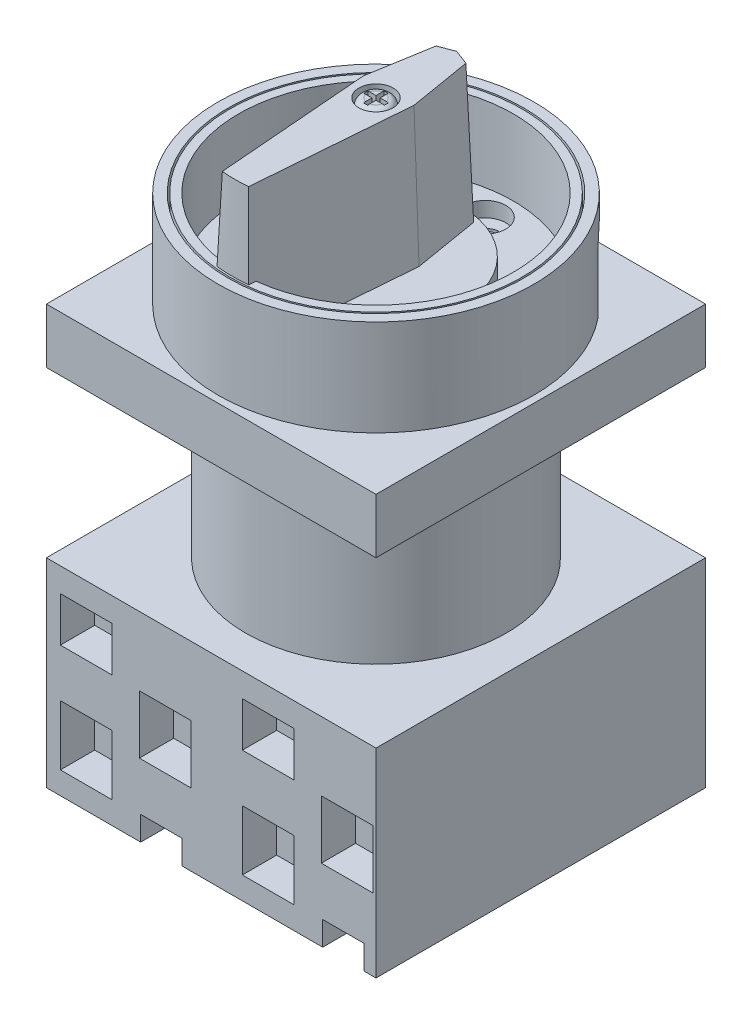
from build123d import *

# Parameters (mm, degrees)
SKETCH1_W                     = 48
SKETCH1_H                     = 48
BOSS_EXTRUDE1_DEPTH           = 29
SKETCH2_R                     = 19
BOSS_EXTRUDE2_DEPTH           = 24
SKETCH3_W                     = 48
SKETCH3_H                     = 48
BOSS_EXTRUDE3_DEPTH           = 8
SKETCH4_R                     = 23
BOSS_EXTRUDE4_DEPTH           = 14
SKETCH5_R                     = 21.5
SKETCH5_R_2                   = 21.25
SKETCH5_R_3                   = 20
CUT_EXTRUDE1_DEPTH            = 11
SKETCH6_R                     = 12.5
BOSS_EXTRUDE5_DEPTH           = 3
BOSS_EXTRUDE6_DEPTH           = 20
BOSS_EXTRUDE6_DRAFT           = 2
BOSS_EXTRUDE6_OTHER_WAY_DEPTH = 3
SKETCH10_R                    = 3
CUT_EXTRUDE2_DEPTH            = 3
SKETCH11_W                    = 7.5
SKETCH11_H                    = 6.5
SKETCH11_H_2                  = 8.737209053
SKETCH11_H_3                  = 8.5
SKETCH11_W_2                  = 6
SKETCH11_H_4                  = 3.5
CUT_EXTRUDE3_DEPTH            = 5
SKETCH12_W                    = 19.5
SKETCH12_H                    = 2.5
SKETCH13_W                    = 1
SKETCH13_H                    = 4
CUT_EXTRUDE4_DEPTH            = 1
SKETCH14_R                    = 2.5
SKETCH14_R_2                  = 2.25
CUT_EXTRUDE5_DEPTH            = 2.5
CUT_EXTRUDE6_DEPTH            = 2
FILLET1_R                     = 1
SKETCH17_R                    = 2
CUT_EXTRUDE7_DEPTH            = 5
CUT_EXTRUDE8_START            = -0.15
CUT_EXTRUDE8_DEPTH            = 5.15
SKETCH20_R                    = 21.5
SKETCH20_R_2                  = 21.25
CUT_EXTRUDE9_DEPTH            = 3
CUT_EXTRUDE10_START           = 0.8
SKETCH21_R                    = 21.25
SKETCH21_R_2                  = 5
CUT_EXTRUDE10_DEPTH           = 0.8


with BuildPart() as part:
    # Sketch1 → Boss-Extrude1 (new body)
    with BuildSketch(Plane(origin=(0, 0, 0), x_dir=(1, 0, 0), z_dir=(0, 1, 0))):
        Rectangle(SKETCH1_W, SKETCH1_H)
    extrude(amount=BOSS_EXTRUDE1_DEPTH)

    # Sketch2 → Boss-Extrude2 (add)
    with BuildSketch(Plane(origin=(0, 29, 0), x_dir=(1, 0, 0), z_dir=(0, 1, 0))):
        with Locations(Location((0, 0, 0), (0, 0, 270))):
            Circle(SKETCH2_R)
    extrude(amount=BOSS_EXTRUDE2_DEPTH)

    # Sketch3 → Boss-Extrude3 (add)
    with BuildSketch(Plane(origin=(0, 53, 0), x_dir=(1, 0, 0), z_dir=(0, 1, 0))):
        Rectangle(SKETCH3_W, SKETCH3_H)
    extrude(amount=BOSS_EXTRUDE3_DEPTH)

    # Sketch4 → Boss-Extrude4 (add)
    with BuildSketch(Plane(origin=(0, 61, 0), x_dir=(1, 0, 0), z_dir=(0, 1, 0))):
        with Locations(Location((0, 0, 0), (0, 0, 270))):
            Circle(SKETCH4_R)
    extrude(amount=BOSS_EXTRUDE4_DEPTH)

    # Sketch5 → Cut-Extrude1 (cut)
    # profile 1 of 2: a face of its own
    with BuildSketch(Plane(origin=(0, 75, 0), x_dir=(1, 0, 0), z_dir=(0, 1, 0))):
        with Locations(Location((0, 0, 0), (0, 0, 270))):
            Circle(SKETCH5_R)
        with Locations(Location((0, 0, 0), (0, 0, 270))):
            Circle(SKETCH5_R_2, mode=Mode.SUBTRACT)
    # profile 2 of 2: a face of its own
    with BuildSketch(Plane(origin=(0, 75, 0), x_dir=(1, 0, 0), z_dir=(0, 1, 0))):
        with Locations(Location((0, 0, 0), (0, 0, 270))):
            Circle(SKETCH5_R_3)
    extrude(amount=-CUT_EXTRUDE1_DEPTH, mode=Mode.SUBTRACT)

    # Sketch6 → Boss-Extrude5 (add)
    with BuildSketch(Plane(origin=(0, 64, 0), x_dir=(1, 0, 0), z_dir=(0, 1, 0))):
        with Locations(Location((0, 0, 0), (0, 0, 270))):
            Circle(SKETCH6_R)
    extrude(amount=BOSS_EXTRUDE5_DEPTH)


with BuildPart() as boss_extrude6_tool:
    # Sketch8 → Boss-Extrude6 (with draft: the straight prism first)
    with BuildSketch(Plane(origin=(0, 67, 0), x_dir=(1, 0, 0), z_dir=(0, 1, 0))):
        with BuildLine():
            Line((2.8, 11.420599394), (0, 12.5))
            Line((0, 12.5), (-2.8, 11.420599394))
            Line((-2.8, 11.420599394), (-4.4, 1.869644477))
            Line((-4.4, 1.869644477), (-2.567945426, -21.094268328))
            ThreePointArc((-2.567945426, -21.094268328), (0, -21.25), (2.567945426, -21.094268328))
            Line((2.567945426, -21.094268328), (4.4, 1.869644477))
            Line((4.4, 1.869644477), (2.8, 11.420599394))
        make_face()
    extrude(amount=BOSS_EXTRUDE6_DEPTH)
    # Boss-Extrude6: the draft: its side faces are tilted about the plane it starts from
    boss_extrude6_sides = [boss_extrude6_tool.faces().sort_by_distance(p)[0] for p in [
        (3.483972713, 77, 9.612311926),
        (3.6, 77, -6.645121935),
        (1.4, 77, -11.960299697),
        (-1.4, 77, -11.960299697),
        (-3.6, 77, -6.645121935),
        (-3.483972713, 77, 9.612311926),
        (0, 77, 21.25),
    ]]
    draft(boss_extrude6_sides, Plane(origin=(0, 67, 0), x_dir=(1, 0, 0), z_dir=(0, 1, 0)), BOSS_EXTRUDE6_DRAFT)


with BuildPart() as part_1:
    add(part.part)

    # Boss-Extrude6: add boss_extrude6_tool
    add(boss_extrude6_tool.part)

    # Sketch8 → Boss-Extrude6 other way (add)
    with BuildSketch(Plane(origin=(0, 67, 0), x_dir=(1, 0, 0), z_dir=(0, 1, 0))):
        with BuildLine():
            Line((2.8, 11.420599394), (0, 12.5))
            Line((0, 12.5), (-2.8, 11.420599394))
            Line((-2.8, 11.420599394), (-4.4, 1.869644477))
            Line((-4.4, 1.869644477), (-2.567945426, -21.094268328))
            ThreePointArc((-2.567945426, -21.094268328), (0, -21.25), (2.567945426, -21.094268328))
            Line((2.567945426, -21.094268328), (4.4, 1.869644477))
            Line((4.4, 1.869644477), (2.8, 11.420599394))
        make_face()
    extrude(amount=-BOSS_EXTRUDE6_OTHER_WAY_DEPTH)

    # Sketch10 → Cut-Extrude2 (cut)
    with BuildSketch(Plane(origin=(0, 64, 0), x_dir=(1, 0, 0), z_dir=(0, 1, 0))):
        with Locations(Location((0, 15.9, 0), (0, 0, 270))):
            Circle(SKETCH10_R)
    extrude(amount=-CUT_EXTRUDE2_DEPTH, mode=Mode.SUBTRACT)

    # Sketch11 → Cut-Extrude3 (cut)
    with BuildSketch(Plane.XY.offset(24)):
        with Locations((-18.215506872, 22.25)):
            Rectangle(SKETCH11_W, SKETCH11_H)
        with Locations((-18.215506872, 7.631395473)):
            Rectangle(SKETCH11_W, SKETCH11_H_2)
        with Locations((-6.715506872, 14.75)):
            Rectangle(SKETCH11_W, SKETCH11_H_3)
        with Locations((8.284493128, 22.25)):
            Rectangle(SKETCH11_W, SKETCH11_H)
        with Locations((19.784493128, 14.75)):
            Rectangle(SKETCH11_W, SKETCH11_H_3)
        with Locations((8.284493128, 7.631395473)):
            Rectangle(SKETCH11_W, SKETCH11_H_2)
        with Locations((-7.265506872, 1.75)):
            Rectangle(SKETCH11_W_2, SKETCH11_H_4)
        with Locations((19.234493128, 1.75)):
            Rectangle(SKETCH11_W_2, SKETCH11_H_4)
    cut_extrude3 = extrude(amount=-CUT_EXTRUDE3_DEPTH, mode=Mode.SUBTRACT)

    # Mirror1: Cut-Extrude3 across plane
    add(cut_extrude3.mirror(Plane.XY), mode=Mode.SUBTRACT)

    # Sketch12 → Cut-Revolve1 (revolve, cut)
    with BuildSketch(Plane.XY, mode=Mode.PRIVATE) as cut_revolve1_sk:
        with Locations((14.25, 51.75)):
            Rectangle(SKETCH12_W, SKETCH12_H)
    revolve(cut_revolve1_sk.sketch.rotate(Axis((0, 89.513245808, 0), (0, -1, 0)), 90), axis=Axis((0, 89.513245808, 0), (0, -1, 0)), mode=Mode.SUBTRACT)

    # Sketch13 → Cut-Extrude4 (cut)
    with BuildSketch(Plane(origin=(0, 61, 0), x_dir=(1, 0, 0), z_dir=(0, 1, 0))):
        with BuildLine():
            Line((-0.25, 17.632050808), (-0.25, 18.136067977))
            ThreePointArc((-0.25, 18.136067977), (-2.25, 15.9), (-0.25, 13.663932023))
            Line((-0.25, 13.663932023), (-0.25, 14.167949192))
            ThreePointArc((-0.25, 14.167949192), (-1.75, 15.9), (-0.25, 17.632050808))
        make_face()
        with BuildLine():
            ThreePointArc((2.25, 15.9), (1.677050983, 17.4), (0.25, 18.136067977))
            Line((0.25, 18.136067977), (0.25, 17.632050808))
            ThreePointArc((0.25, 17.632050808), (1.322875656, 17.045643924), (1.75, 15.9))
            ThreePointArc((1.75, 15.9), (1.322875656, 14.754356076), (0.25, 14.167949192))
            Line((0.25, 14.167949192), (0.25, 13.663932023))
            ThreePointArc((0.25, 13.663932023), (1.677050983, 14.4), (2.25, 15.9))
        make_face()
        with Locations((13.75, 9)):
            Rectangle(SKETCH13_W, SKETCH13_H)
    extrude(amount=-CUT_EXTRUDE4_DEPTH, mode=Mode.SUBTRACT)

    # Sketch14 → Cut-Extrude5 (cut)
    with BuildSketch(Plane(origin=(0, 87, 0), x_dir=(1, 0, 0), z_dir=(0, 1, 0))):
        with Locations(Location((0, 0, 0), (0, 0, 270))):
            Circle(SKETCH14_R)
        with Locations(Location((0, 0, 0), (0, 0, 270))):
            Circle(SKETCH14_R_2, mode=Mode.SUBTRACT)
    extrude(amount=-CUT_EXTRUDE5_DEPTH, mode=Mode.SUBTRACT)

    # Sketch16 → Cut-Extrude6 (cut)
    with BuildSketch(Plane(origin=(0, 87, 0), x_dir=(1, 0, 0), z_dir=(0, 1, 0))):
        Polygon((-0.3, 1.5), (-0.3, 0.3), (-1.5, 0.3), (-1.5, -0.3), (-0.3, -0.3), (-0.3, -1.5), (0.3, -1.5), (0.3, -0.3), (1.5, -0.3), (1.5, 0.3), (0.3, 0.3), (0.3, 1.5), align=None)
    extrude(amount=-CUT_EXTRUDE6_DEPTH, mode=Mode.SUBTRACT)

    # Fillet1
    # the kernel refuses this fillet: 1 mm, written as the material it takes off along each edge
    with BuildSketch(Plane(origin=(0, 87, 0), x_dir=(0, 0, 1), z_dir=(-1, 0, 0))) as fillet1_piece_1:
        with BuildLine():
            CenterArc((2.25 - FILLET1_R, -FILLET1_R), FILLET1_R, 0, 90)
            Line((2.25 - FILLET1_R, 0), (2.25, 0))
            Line((2.25, 0), (2.25, -FILLET1_R))
        make_face()
    revolve(axis=Axis((0, 87, 0), (0, 1, 0)), mode=Mode.SUBTRACT)

    # Sketch17 → Cut-Extrude7 (cut)
    with BuildSketch(Plane.XZ.offset(-53)):
        with Locations(Location((-19, -19, 0), (0, 0, 270))):
            Circle(SKETCH17_R)
        with Locations(Location((-19, 19, 0), (0, 0, 270))):
            Circle(SKETCH17_R)
        with Locations(Location((19, 19, 0), (0, 0, 270))):
            Circle(SKETCH17_R)
        with Locations(Location((19, -19, 0), (0, 0, 270))):
            Circle(SKETCH17_R)
    extrude(amount=-CUT_EXTRUDE7_DEPTH, mode=Mode.SUBTRACT)

    # Sketch19 → Cut-Extrude8 (cut)
    with BuildSketch(Plane(origin=(-14.142135624, 0, -14.142135624), x_dir=(-0.7071067811865523, 0, 0.7071067811865427), z_dir=(-0.7071067811865427, 0, -0.7071067811865523)).offset(CUT_EXTRUDE8_START)):
        with BuildLine():
            Line((-2.5, 69.5), (-2.5, 61))
            Line((-2.5, 61), (2.5, 61))
            Line((2.5, 61), (2.5, 69.5))
            ThreePointArc((2.5, 69.5), (0, 67), (-2.5, 69.5))
        make_face()
        with BuildLine():
            ThreePointArc((2.5, 69.5), (0, 72), (-2.5, 69.5))
            Line((-2.5, 69.5), (2.5, 69.5))
        make_face()
        with BuildLine():
            Line((2.5, 69.5), (-2.5, 69.5))
            ThreePointArc((-2.5, 69.5), (0, 67), (2.5, 69.5))
        make_face()
    cut_extrude8 = extrude(amount=CUT_EXTRUDE8_DEPTH, mode=Mode.SUBTRACT)

    # Sketch20 → Cut-Extrude9 (cut)
    with BuildSketch(Plane(origin=(0, 64, 0), x_dir=(1, 0, 0), z_dir=(0, 1, 0))):
        with Locations(Location((0, 0, 0), (0, 0, 270))):
            Circle(SKETCH20_R)
        with Locations(Location((0, 0, 0), (0, 0, 270))):
            Circle(SKETCH20_R_2, mode=Mode.SUBTRACT)
    extrude(amount=-CUT_EXTRUDE9_DEPTH, mode=Mode.SUBTRACT)

    # Sketch21 → Cut-Extrude10 (cut)
    with BuildSketch(Plane(origin=(0, 61, 0), x_dir=(1, 0, 0), z_dir=(0, 1, 0)).offset(CUT_EXTRUDE10_START)):
        with Locations(Location((0, 0, 0), (0, 0, 270))):
            Circle(SKETCH21_R)
        with Locations(Location((0, 0, 0), (0, 0, 270))):
            Circle(SKETCH21_R_2, mode=Mode.SUBTRACT)
    extrude(amount=-CUT_EXTRUDE10_DEPTH, mode=Mode.SUBTRACT)

    # Mirror2: Cut-Extrude8 across plane
    add(cut_extrude8.mirror(Plane(origin=(0, 0, 0), x_dir=(0, 0, 1), z_dir=(1, 0, 0))), mode=Mode.SUBTRACT)


solid = part_1.part
